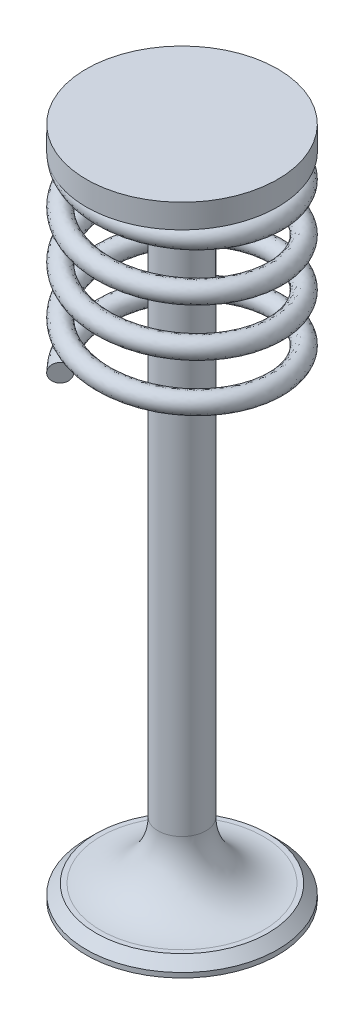
from build123d import *

# Parameters (mm, degrees)
SWEEP1_PITCH = 5


with BuildPart() as part:
    # Sketch1 → Revolve1 (revolve)
    with BuildSketch(Plane.XY, mode=Mode.PRIVATE) as revolve1_sk:
        with BuildLine():
            Line((10, 0), (0, 0))
            Line((0, 0), (0, 70.2))
            Line((0, 70.2), (10, 70.2))
            Line((10, 70.2), (10, 67.7))
            Line((10, 67.7), (2.5, 67.7))
            Line((2.5, 67.7), (2.5, 7.5))
            ThreePointArc((2.5, 7.5), (4.257359313, 3.257359313), (8.5, 1.5))
            Line((8.5, 1.5), (9, 1.5))
            Line((9, 1.5), (10, 0.5))
            Line((10, 0.5), (10, 0))
        make_face()
    revolve(revolve1_sk.sketch.rotate(Axis((0, 0, 0), (0, 1, 0)), 90), axis=Axis((0, 0, 0), (0, 1, 0)))

    # Sweep1: the profile of Sweep1 profile screwed along a left-hand helix of 4 turns, 12 arcs to a turn; built about Z, then put on its axis
    sweep1_z = Axis((0, 0, 0), (0, 0, 1))
    sweep1_corners = [(8, 0, 0), (9, -0.088075795, -0.996113776), (10, 0, 0), (9, 0.088075795, 0.996113776)]
    with BuildLine(mode=Mode.PRIVATE) as sweep1_profile:
        ThreePointArc((8, 0, 0), (8.292893219, -0.062278992, -0.704358806), (9, -0.088075795, -0.996113776))
        ThreePointArc((9, -0.088075795, -0.996113776), (9.707106781, -0.062278992, -0.704358806), (10, 0, 0))
        ThreePointArc((10, 0, 0), (9.707106781, 0.062278992, 0.704358806), (9, 0.088075795, 0.996113776))
        ThreePointArc((9, 0.088075795, 0.996113776), (8.292893219, 0.062278992, 0.704358806), (8, 0, 0))
    sweep1_cap = Face(sweep1_profile.wire())
    sweep1_arcs = [((8, 0, 0), (8, -0.088075795, -0.996113776), (9, -0.088075795, -0.996113776), (1, 0.7071067811865476, 1)), ((9, -0.088075795, -0.996113776), (10, -0.088075795, -0.996113776), (10, 0, 0), (1, 0.7071067811865476, 1)), ((10, 0, 0), (10, 0.088075795, 0.996113776), (9, 0.088075795, 0.996113776), (1, 0.7071067811865476, 1)), ((9, 0.088075795, 0.996113776), (8, 0.088075795, 0.996113776), (8, 0, 0), (1, 0.7071067811865476, 1))]  # start, shoulder, end, weights
    sweep1_turn_angles = [0, -15, -30, -45, -60, -75, -90, -105, -120, -135, -150, -165, -180, -195, -210, -225, -240, -255, -270, -285, -300, -315, -330, -345, -360]
    sweep1_turn_weights = [1, 0.9659258262890683, 1, 0.9659258262890683, 1, 0.9659258262890683, 1, 0.9659258262890683, 1, 0.9659258262890683, 1, 0.9659258262890683, 1, 0.9659258262890683, 1, 0.9659258262890683, 1, 0.9659258262890683, 1, 0.9659258262890683, 1, 0.9659258262890683, 1, 0.9659258262890683, 1]
    sweep1_turn_sides = [Face.make_bezier_surface([[Vector(p[j][0], p[j][1], 0).rotate(sweep1_z, sweep1_turn_angles[2 * i + k]) / sweep1_turn_weights[2 * i + k] + Vector(0, 0, p[j][2] + -SWEEP1_PITCH * sweep1_turn_angles[2 * i + k] / 360) for k in range(3)] for j in range(3)], [[p[3][j] * sweep1_turn_weights[2 * i + k] for k in range(3)] for j in range(3)]) for p in sweep1_arcs for i in range(12)]
    sweep1 = Plane(origin=(0, 67.7, 0), x_dir=(-0.7071067811865537, 0, 0.7071067811865414), z_dir=(0, -1, 0)) * Solid(Shell([*[p.moved(Location((0, 0, SWEEP1_PITCH * i))) for i in range(4) for p in sweep1_turn_sides], sweep1_cap, sweep1_cap.rotate(sweep1_z, -1440).moved(Location((0, 0, -SWEEP1_PITCH * -1440 / 360)))]))
    add(sweep1)


solid = part.part
